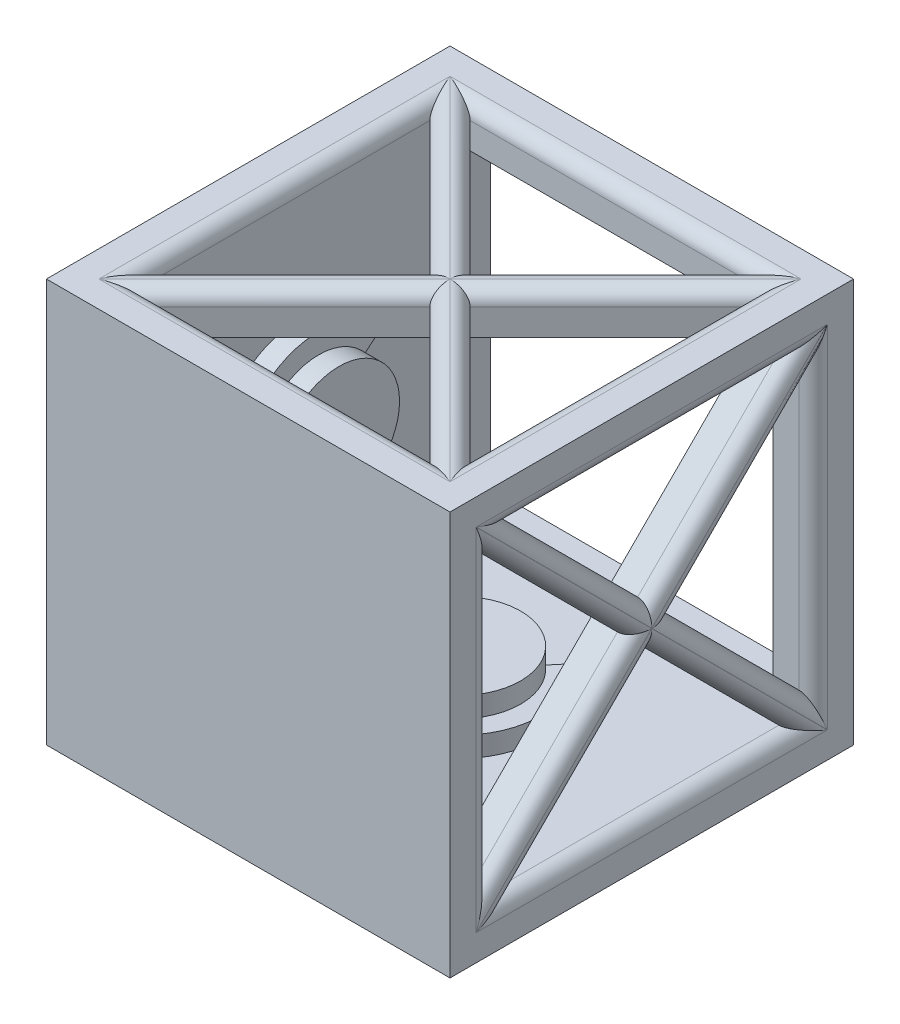
from build123d import *

# Parameters (mm, degrees)
SKETCH1_W            = 100
SKETCH1_H            = 100
BOSS_EXTRUDE1_DEPTH  = 100
SKETCH2_W            = 80
SKETCH2_H            = 80
CUT_EXTRUDE1_DEPTH   = 100
SKETCH3_W            = 80
SKETCH3_H            = 80
CUT_EXTRUDE2_DEPTH   = 100
CUT_EXTRUDE3_DEPTH   = 100
FILLET39_R           = 3.505
FILLET40_R           = 3.505
FILLET41_R           = 3.505
FILLET42_R           = 3.505
SKETCH5_W            = 80
SKETCH5_H            = 5
BOSS_EXTRUDE2_DEPTH  = 80
BOSS_EXTRUDE4_DEPTH  = 10
FILLET106_R          = 3.505
FILLET107_R          = 3.505
FILLET108_R          = 3.505
FILLET109_R          = 3.505
SKETCH10_W           = 100
SKETCH10_H           = 100
BOSS_EXTRUDE6_DEPTH  = 10
SKETCH11_W           = 100
SKETCH11_H           = 100
BOSS_EXTRUDE7_DEPTH  = 10
SKETCH12_R           = 15
BOSS_EXTRUDE8_DEPTH  = 10
BOSS_EXTRUDE9_DEPTH  = 5
SKETCH18_R           = 15
BOSS_EXTRUDE10_DEPTH = 10
BOSS_EXTRUDE11_DEPTH = 5
CUT_EXTRUDE4_DEPTH   = 10
SKETCH26_W           = 91.840928508
SKETCH26_H           = 89.348142656
BOSS_EXTRUDE12_DEPTH = 10
FILLET113_R          = 3.505
FILLET114_R          = 3.505
SKETCH28_R           = 15
BOSS_EXTRUDE13_DEPTH = 10
BOSS_EXTRUDE14_DEPTH = 5
FILLET115_R          = 3.505


# Some blends are built 0.0001 mm under size
with BuildPart() as part:
    # Sketch1 → Boss-Extrude1 (new body)
    with BuildSketch(Plane(origin=(0, 0, 0), x_dir=(1, 0, 0), z_dir=(0, 1, 0))):
        with Locations((-13.586701651, 24.731769861)):
            Rectangle(SKETCH1_W, SKETCH1_H)
    extrude(amount=BOSS_EXTRUDE1_DEPTH)

    # Sketch2 → Cut-Extrude1 (cut)
    with BuildSketch(Plane(origin=(0, 100, 0), x_dir=(1, 0, 0), z_dir=(0, 1, 0))):
        with Locations((-13.586701651, 24.731769861)):
            Rectangle(SKETCH2_W, SKETCH2_H)
    extrude(amount=-CUT_EXTRUDE1_DEPTH, mode=Mode.SUBTRACT)

    # Sketch3 → Cut-Extrude2 (cut)
    with BuildSketch(Plane.XY.offset(25.268230139)):
        with Locations((-13.586701651, 50)):
            Rectangle(SKETCH3_W, SKETCH3_H)
    extrude(amount=-CUT_EXTRUDE2_DEPTH, mode=Mode.SUBTRACT)

    # Sketch4 → Cut-Extrude3 (cut)
    with BuildSketch(Plane.ZY.offset(63.586701651)):
        Polygon((-59.731769861, 10), (10.268230139, 10), (-24.731769861, 45), align=None)
        Polygon((-64.731769861, 15), (-29.731769861, 50), (-64.731769861, 85), align=None)
        Polygon((-59.731769861, 90), (-24.731769861, 55), (10.268230139, 90), align=None)
        Polygon((-19.731769861, 50), (15.268230139, 15), (15.268230139, 85), align=None)
    extrude(amount=-CUT_EXTRUDE3_DEPTH, mode=Mode.SUBTRACT)

    # Fillet39
    # the kernel refuses this fillet: 3.505 mm, written as the material it adds along each edge
    with BuildSketch(Plane(origin=(-63.586701651, 45, -24.731769861), x_dir=(0, -0.7071067811865476, -0.7071067811865476), z_dir=(1, 0, 0))) as fillet39_piece_1:
        with BuildLine():
            CenterArc((FILLET39_R, -FILLET39_R), FILLET39_R, 90, 90)
            Line((0, -FILLET39_R), (0, 0))
            Line((0, 0), (FILLET39_R, 0))
        make_face()
    extrude(amount=10)
    with BuildSketch(Plane(origin=(-63.586701651, 10, 10.268230139), x_dir=(0, 0, -1), z_dir=(1, 0, 0))) as fillet39_piece_2:
        with BuildLine():
            CenterArc((FILLET39_R * 2.41421356237, FILLET39_R), FILLET39_R, 135, 135)
            Line((FILLET39_R * 1.70710678119, FILLET39_R * 1.70710678119), (0, 0))
            Line((0, 0), (FILLET39_R * 2.41421356237, 0))
        make_face()
    extrude(amount=10)
    # the kernel refuses this fillet: 3.505 mm, written as the material it takes off along each edge
    with BuildSketch(Plane(origin=(-63.586701651, 15.983409268, 4.284820871), x_dir=(0, 0.7071067811865476, 0.7071067811865476), z_dir=(0, 0.7071067811865475, -0.7071067811865476)), Plane(origin=(-53.586701651, 42.521590732, -22.253360593), x_dir=(0, 0.7071067811865476, 0.7071067811865476), z_dir=(0, -0.7071067811865475, 0.7071067811865476))) as fillet39_2_piece_1:
        with BuildLine():
            CenterArc((FILLET39_R, FILLET39_R), FILLET39_R, 180, 90)
            Line((0, FILLET39_R), (0, 0))
            Line((0, 0), (FILLET39_R, 0))
        make_face()
    extrude(amount=37.530656147, mode=Mode.SUBTRACT)
    with BuildSketch(Plane(origin=(-63.586701651, 10, -68.494269861), x_dir=(0, -1, 0), z_dir=(0, 0, 1))) as fillet39_2_piece_2_section:
        with BuildLine():
            CenterArc((FILLET39_R, FILLET39_R), FILLET39_R, 180, 90)
            Line((0, FILLET39_R), (0, 0))
            Line((0, 0), (FILLET39_R, 0))
        make_face()
    fillet39_2_piece_2 = extrude(amount=70.300681464, mode=Mode.PRIVATE)
    fillet39_2_piece_2 = split(fillet39_2_piece_2, bisect_by=Plane(origin=(-62.798598249, 24.782539109, -44.949230752), z_dir=(0, -0.7071067811865476, 0.7071067811865476)), keep=Keep.TOP, mode=Mode.PRIVATE)
    add(fillet39_2_piece_2, mode=Mode.SUBTRACT)
    with BuildSketch(Plane(origin=(-53.586701651, 3.80397683, -65.927793031), x_dir=(0, 0.7071067811865475, -0.7071067811865475), z_dir=(0, 0.7071067811865476, 0.7071067811865476))) as fillet39_2_piece_3_section:
        with BuildLine():
            CenterArc((FILLET39_R, FILLET39_R), FILLET39_R, 180, 90)
            Line((0, FILLET39_R), (0, 0))
            Line((0, 0), (FILLET39_R, 0))
        make_face()
    fillet39_2_piece_3 = extrude(amount=54.754974683, mode=Mode.PRIVATE)
    fillet39_2_piece_3 = split(fillet39_2_piece_3, bisect_by=Plane(origin=(-54.373006967, 10, -44.325568199), z_dir=(0, 1, 0)), keep=Keep.TOP, mode=Mode.PRIVATE)
    add(fillet39_2_piece_3, mode=Mode.SUBTRACT)
    with BuildSketch(Plane(origin=(-53.586701651, 10, 1.806411603), x_dir=(0, -1, 0), z_dir=(0, 0, -1))) as fillet39_2_piece_4_section:
        with BuildLine():
            CenterArc((FILLET39_R, FILLET39_R), FILLET39_R, 180, 90)
            Line((0, FILLET39_R), (0, 0))
            Line((0, 0), (FILLET39_R, 0))
        make_face()
    fillet39_2_piece_4 = extrude(amount=70.300681464, mode=Mode.PRIVATE)
    fillet39_2_piece_4 = split(fillet39_2_piece_4, bisect_by=Plane(origin=(-54.374805052, 24.782539109, -44.949230752), z_dir=(0, -0.7071067811865476, 0.7071067811865476)), keep=Keep.TOP, mode=Mode.PRIVATE)
    add(fillet39_2_piece_4, mode=Mode.SUBTRACT)
    with BuildSketch(Plane(origin=(-63.586701651, 42.521590732, -27.210179129), x_dir=(0, 0.7071067811865476, -0.7071067811865476), z_dir=(0, -0.7071067811865476, -0.7071067811865476))) as fillet39_2_piece_5_section:
        with BuildLine():
            CenterArc((FILLET39_R, FILLET39_R), FILLET39_R, 180, 90)
            Line((0, FILLET39_R), (0, 0))
            Line((0, 0), (FILLET39_R, 0))
        make_face()
    fillet39_2_piece_5 = extrude(amount=54.754974683, mode=Mode.PRIVATE)
    fillet39_2_piece_5 = split(fillet39_2_piece_5, bisect_by=Plane(origin=(-62.800396334, 10, -44.325568199), z_dir=(0, 1, 0)), keep=Keep.TOP, mode=Mode.PRIVATE)
    add(fillet39_2_piece_5, mode=Mode.SUBTRACT)
    with BuildSketch(Plane(origin=(-63.586701651, 40.043181464, -24.731769861), x_dir=(0, 0.7071067811865476, -0.7071067811865476), z_dir=(0, -0.7071067811865476, -0.7071067811865476))) as fillet39_2_piece_6:
        with BuildLine():
            CenterArc((3.505 + FILLET39_R, FILLET39_R), FILLET39_R, 180, 90)
            Line((3.505, FILLET39_R), (3.505, 0))
            Line((3.505, 0), (3.505 + FILLET39_R, 0))
        make_face()
    revolve(axis=Axis((-63.586701651, 40.043181464, -24.731769861), (1, 0, 0)), revolution_arc=90, mode=Mode.SUBTRACT)
    with BuildSketch(Plane(origin=(-53.586701651, 13.505, 1.806411603), x_dir=(0, -1, 0), z_dir=(0, 0, -1))) as fillet39_2_piece_7:
        with BuildLine():
            CenterArc((3.505 + FILLET39_R, FILLET39_R), FILLET39_R, 180, 90)
            Line((3.505, FILLET39_R), (3.505, 0))
            Line((3.505, 0), (3.505 + FILLET39_R, 0))
        make_face()
    revolve(axis=Axis((-53.586701651, 13.505, 1.806411603), (-1, 0, 0)), revolution_arc=135, mode=Mode.SUBTRACT)
    with BuildSketch(Plane(origin=(-53.586701651, 40.043181464, -24.731769861), x_dir=(0, 0.7071067811865476, -0.7071067811865476), z_dir=(0, -0.7071067811865476, -0.7071067811865476))) as fillet39_2_piece_8:
        with BuildLine():
            CenterArc((3.505 + FILLET39_R, -FILLET39_R), FILLET39_R, 90, 90)
            Line((3.505, -FILLET39_R), (3.505, 0))
            Line((3.505, 0), (3.505 + FILLET39_R, 0))
        make_face()
    revolve(axis=Axis((-53.586701651, 40.043181464, -24.731769861), (1, 0, 0)), revolution_arc=90, mode=Mode.SUBTRACT)
    with BuildSketch(Plane(origin=(-63.586701651, 13.505, 1.806411603), x_dir=(0, -1, 0), z_dir=(0, 0, -1))) as fillet39_2_piece_9:
        with BuildLine():
            CenterArc((3.505 + FILLET39_R, -FILLET39_R), FILLET39_R, 90, 90)
            Line((3.505, -FILLET39_R), (3.505, 0))
            Line((3.505, 0), (3.505 + FILLET39_R, 0))
        make_face()
    revolve(axis=Axis((-63.586701651, 13.505, 1.806411603), (-1, 0, 0)), revolution_arc=135, mode=Mode.SUBTRACT)
    with BuildSketch(Plane(origin=(-63.586701651, 42.521590732, -27.210179129), x_dir=(0, 0.7071067811865476, -0.7071067811865476), z_dir=(0, -0.7071067811865476, -0.7071067811865476))) as fillet39_2_piece_10a_section:
        with BuildLine():
            CenterArc((FILLET39_R, FILLET39_R), FILLET39_R, 180, 90)
            Line((0, FILLET39_R), (0, 0))
            Line((0, 0), (FILLET39_R, 0))
        make_face()
    fillet39_2_piece_10a = extrude(amount=54.754974683, mode=Mode.PRIVATE)
    fillet39_2_piece_10a = split(fillet39_2_piece_10a, bisect_by=Plane(origin=(-62.750859381, 10, -63.595436252), z_dir=(0, -1, 0)), keep=Keep.TOP, mode=Mode.PRIVATE)
    with BuildSketch(Plane(origin=(-63.586701651, 10, -68.494269861), x_dir=(0, -1, 0), z_dir=(0, 0, 1))) as fillet39_2_piece_10b_section:
        with BuildLine():
            CenterArc((FILLET39_R, FILLET39_R), FILLET39_R, 180, 90)
            Line((0, FILLET39_R), (0, 0))
            Line((0, 0), (FILLET39_R, 0))
        make_face()
    fillet39_2_piece_10b = extrude(amount=70.300681464, mode=Mode.PRIVATE)
    fillet39_2_piece_10b = split(fillet39_2_piece_10b, bisect_by=Plane(origin=(-62.750859381, 7.267975294, -62.463794567), z_dir=(0, 0.7071067811865476, -0.7071067811865476)), keep=Keep.TOP, mode=Mode.PRIVATE)
    fillet39_2_piece_10 = fillet39_2_piece_10a & fillet39_2_piece_10b
    add(fillet39_2_piece_10, mode=Mode.SUBTRACT)
    with BuildSketch(Plane(origin=(-53.586701651, 3.80397683, -65.927793031), x_dir=(0, 0.7071067811865475, -0.7071067811865475), z_dir=(0, 0.7071067811865476, 0.7071067811865476))) as fillet39_2_piece_11a_section:
        with BuildLine():
            CenterArc((FILLET39_R, FILLET39_R), FILLET39_R, 180, 90)
            Line((0, FILLET39_R), (0, 0))
            Line((0, 0), (FILLET39_R, 0))
        make_face()
    fillet39_2_piece_11a = extrude(amount=54.754974683, mode=Mode.PRIVATE)
    fillet39_2_piece_11a = split(fillet39_2_piece_11a, bisect_by=Plane(origin=(-54.503230396, 7.913859932, -64.731769861), z_dir=(0, 0, 1)), keep=Keep.TOP, mode=Mode.PRIVATE)
    fillet39_2_piece_11a = split(fillet39_2_piece_11a, bisect_by=Plane(origin=(-54.503230396, 10, -62.645629793), z_dir=(0, -1, 0)), keep=Keep.TOP, mode=Mode.PRIVATE)
    with BuildSketch(Plane(origin=(-53.586701651, 10, 1.806411603), x_dir=(0, -1, 0), z_dir=(0, 0, -1))) as fillet39_2_piece_11b_section:
        with BuildLine():
            CenterArc((FILLET39_R, FILLET39_R), FILLET39_R, 180, 90)
            Line((0, FILLET39_R), (0, 0))
            Line((0, 0), (FILLET39_R, 0))
        make_face()
    fillet39_2_piece_11b = extrude(amount=70.300681464, mode=Mode.PRIVATE)
    fillet39_2_piece_11b = split(fillet39_2_piece_11b, bisect_by=Plane(origin=(-54.460403752, 9.342219977, -64.731769861), z_dir=(0, 0, 1)), keep=Keep.TOP, mode=Mode.PRIVATE)
    fillet39_2_piece_11b = split(fillet39_2_piece_11b, bisect_by=Plane(origin=(-54.460403752, 8.256664983, -61.475104878), z_dir=(0, 0.7071067811865476, -0.7071067811865476)), keep=Keep.TOP, mode=Mode.PRIVATE)
    fillet39_2_piece_11 = fillet39_2_piece_11a & fillet39_2_piece_11b
    add(fillet39_2_piece_11, mode=Mode.SUBTRACT)

    # Fillet40
    fillet40_edges = [part.edges().sort_by_distance(p)[0] for p in [
        (-63.586701651, 72.5, -42.231769861),
        (-58.586701651, 90, -59.731769861),
        (-63.586701651, 90, -24.731769861),
        (-53.586701651, 72.5, -7.231769861),
        (-58.586701651, 90, 10.268230139),
        (-53.586701651, 72.5, -42.231769861),
        (-53.586701651, 90, -24.731769861),
        (-63.586701651, 72.5, -7.231769861),
    ]]
    fillet(fillet40_edges, radius=FILLET40_R)

    # Fillet41
    fillet41_edges = [part.edges().sort_by_distance(p)[0] for p in [
        (-58.586701651, 85, 15.268230139),
        (-63.586701651, 50, 15.268230139),
        (-58.586701651, 15, 15.268230139),
        (-63.586701651, 32.5, -2.231769861),
        (-53.586701651, 67.5, -2.231769861),
        (-53.586701651, 50, 15.268230139),
        (-53.586701651, 32.5, -2.231769861),
        (-63.586701651, 67.5, -2.231769861),
    ]]
    fillet(fillet41_edges, radius=FILLET41_R - 0.0001)  # a hair under: the kernel refuses the full size

    # Fillet42
    # the kernel refuses this fillet: 3.505 mm, written as the material it adds along each edge
    with BuildSketch(Plane(origin=(-63.586701651, 85, -64.731769861), x_dir=(0, -1, 0), z_dir=(1, 0, 0))) as fillet42_piece_1:
        with BuildLine():
            CenterArc((FILLET42_R * 2.41421356237, -FILLET42_R), FILLET42_R, 90, 135)
            Line((FILLET42_R * 1.70710678119, -FILLET42_R * 1.70710678119), (0, 0))
            Line((0, 0), (FILLET42_R * 2.41421356237, 0))
        make_face()
    extrude(amount=10)
    with BuildSketch(Plane(origin=(-63.586701651, 50, -29.731769861), x_dir=(0, 0.7071067811865465, -0.7071067811865486), z_dir=(1, 0, 0))) as fillet42_piece_2:
        with BuildLine():
            CenterArc((FILLET42_R, -FILLET42_R), FILLET42_R, 90, 90)
            Line((0, -FILLET42_R), (0, 0))
            Line((0, 0), (FILLET42_R, 0))
        make_face()
    extrude(amount=10)
    # the kernel refuses this fillet: 3.505 mm, written as the material it takes off along each edge
    with BuildSketch(Plane(origin=(-63.586701651, 76.538181464, -64.731769861), x_dir=(0, 0, -1), z_dir=(0, -1, 0))) as fillet42_2_piece_1_section:
        with BuildLine():
            CenterArc((FILLET42_R, FILLET42_R), FILLET42_R, 180, 90)
            Line((0, FILLET42_R), (0, 0))
            Line((0, 0), (FILLET42_R, 0))
        make_face()
    fillet42_2_piece_1 = extrude(amount=70.300681464, mode=Mode.PRIVATE)
    fillet42_2_piece_1 = split(fillet42_2_piece_1, bisect_by=Plane(origin=(-62.798598249, 29.782539109, -49.949230752), z_dir=(0, 0.7071067811865477, -0.7071067811865475)), keep=Keep.TOP, mode=Mode.PRIVATE)
    add(fillet42_2_piece_1, mode=Mode.SUBTRACT)
    with BuildSketch(Plane(origin=(-63.586701651, 52.478409268, -32.210179129), x_dir=(-5.270787768833835e-14, 0.7071067811865476, 0.7071067811865474), z_dir=(0, 0.7071067811865475, -0.7071067811865476)), Plane(origin=(-53.586701651, 79.016590732, -58.748360593), x_dir=(-5.473510375327444e-14, 0.7071067811865476, 0.7071067811865474), z_dir=(0, -0.7071067811865475, 0.7071067811865476))) as fillet42_2_piece_2:
        with BuildLine():
            CenterArc((FILLET42_R, FILLET42_R), FILLET42_R, 180, 90)
            Line((0, FILLET42_R), (0, 0))
            Line((0, 0), (FILLET42_R, 0))
        make_face()
    extrude(amount=37.530656147, mode=Mode.SUBTRACT)
    with BuildSketch(Plane(origin=(-53.586701651, 47.521590732, -32.210179129), x_dir=(-1, 0, 0), z_dir=(0, -0.7071067811865475, -0.7071067811865477))) as fillet42_2_piece_3_section:
        with BuildLine():
            CenterArc((FILLET42_R, -FILLET42_R), FILLET42_R, 90, 90)
            Line((0, -FILLET42_R), (0, 0))
            Line((0, 0), (FILLET42_R, 0))
        make_face()
    fillet42_2_piece_3 = extrude(amount=54.754974683, mode=Mode.PRIVATE)
    fillet42_2_piece_3 = split(fillet42_2_piece_3, bisect_by=Plane(origin=(-54.373006967, 30.406201662, -64.731769861), z_dir=(0, 0, 1)), keep=Keep.TOP, mode=Mode.PRIVATE)
    add(fillet42_2_piece_3, mode=Mode.SUBTRACT)
    with BuildSketch(Plane(origin=(-53.586701651, 6.2375, -64.731769861), x_dir=(0, 0, -1), z_dir=(0, 1, 0))) as fillet42_2_piece_4_section:
        with BuildLine():
            CenterArc((FILLET42_R, FILLET42_R), FILLET42_R, 180, 90)
            Line((0, FILLET42_R), (0, 0))
            Line((0, 0), (FILLET42_R, 0))
        make_face()
    fillet42_2_piece_4 = extrude(amount=70.300681464, mode=Mode.PRIVATE)
    fillet42_2_piece_4 = split(fillet42_2_piece_4, bisect_by=Plane(origin=(-54.374805052, 29.782539109, -49.949230752), z_dir=(0, 0.7071067811865477, -0.7071067811865475)), keep=Keep.TOP, mode=Mode.PRIVATE)
    add(fillet42_2_piece_4, mode=Mode.SUBTRACT)
    with BuildSketch(Plane(origin=(-63.586701651, 8.80397683, -70.927793031), x_dir=(0, -0.7071067811865476, 0.7071067811865474), z_dir=(0, 0.7071067811865475, 0.7071067811865477))) as fillet42_2_piece_5_section:
        with BuildLine():
            CenterArc((FILLET42_R, FILLET42_R), FILLET42_R, 180, 90)
            Line((0, FILLET42_R), (0, 0))
            Line((0, 0), (FILLET42_R, 0))
        make_face()
    fillet42_2_piece_5 = extrude(amount=54.754974683, mode=Mode.PRIVATE)
    fillet42_2_piece_5 = split(fillet42_2_piece_5, bisect_by=Plane(origin=(-62.800396334, 30.406201662, -64.731769861), z_dir=(0, 0, 1)), keep=Keep.TOP, mode=Mode.PRIVATE)
    add(fillet42_2_piece_5, mode=Mode.SUBTRACT)
    with BuildSketch(Plane(origin=(-63.586701651, 50, -34.688588397), x_dir=(0, 0.7071067811865476, 0.7071067811865476), z_dir=(0, 0.7071067811865476, -0.7071067811865476))) as fillet42_2_piece_6:
        with BuildLine():
            CenterArc((3.505 + FILLET42_R, FILLET42_R), FILLET42_R, 180, 90)
            Line((3.505, FILLET42_R), (3.505, 0))
            Line((3.505, 0), (3.505 + FILLET42_R, 0))
        make_face()
    revolve(axis=Axis((-63.586701651, 50, -34.688588397), (1, 0, 0)), revolution_arc=90, mode=Mode.SUBTRACT)
    with BuildSketch(Plane(origin=(-53.586701651, 76.538181464, -61.226769861), x_dir=(0, 0, -1), z_dir=(0, -1, 0))) as fillet42_2_piece_7:
        with BuildLine():
            CenterArc((3.505 + FILLET42_R, -FILLET42_R), FILLET42_R, 90, 90)
            Line((3.505, -FILLET42_R), (3.505, 0))
            Line((3.505, 0), (3.505 + FILLET42_R, 0))
        make_face()
    revolve(axis=Axis((-53.586701651, 76.538181464, -61.226769861), (1, 0, 0)), revolution_arc=135, mode=Mode.SUBTRACT)
    with BuildSketch(Plane(origin=(-53.586701651, 50, -34.688588397), x_dir=(0, 0.7071067811865476, 0.7071067811865476), z_dir=(0, 0.7071067811865476, -0.7071067811865476))) as fillet42_2_piece_8:
        with BuildLine():
            CenterArc((3.505 + FILLET42_R, -FILLET42_R), FILLET42_R, 90, 90)
            Line((3.505, -FILLET42_R), (3.505, 0))
            Line((3.505, 0), (3.505 + FILLET42_R, 0))
        make_face()
    revolve(axis=Axis((-53.586701651, 50, -34.688588397), (1, 0, 0)), revolution_arc=90, mode=Mode.SUBTRACT)
    with BuildSketch(Plane(origin=(-63.586701651, 76.538181464, -61.226769861), x_dir=(0, 0, -1), z_dir=(0, -1, 0))) as fillet42_2_piece_9:
        with BuildLine():
            CenterArc((3.505 + FILLET42_R, FILLET42_R), FILLET42_R, 180, 90)
            Line((3.505, FILLET42_R), (3.505, 0))
            Line((3.505, 0), (3.505 + FILLET42_R, 0))
        make_face()
    revolve(axis=Axis((-63.586701651, 76.538181464, -61.226769861), (1, 0, 0)), revolution_arc=135, mode=Mode.SUBTRACT)
    with BuildSketch(Plane(origin=(-63.586701651, 76.538181464, -64.731769861), x_dir=(0, 0, -1), z_dir=(0, -1, 0))) as fillet42_2_piece_10a_section:
        with BuildLine():
            CenterArc((FILLET42_R, FILLET42_R), FILLET42_R, 180, 90)
            Line((0, FILLET42_R), (0, 0))
            Line((0, 0), (FILLET42_R, 0))
        make_face()
    fillet42_2_piece_10a = extrude(amount=70.300681464, mode=Mode.PRIVATE)
    fillet42_2_piece_10a = split(fillet42_2_piece_10a, bisect_by=Plane(origin=(-62.750859381, 12.267975294, -67.463794567), z_dir=(0, -0.7071067811865477, 0.7071067811865475)), keep=Keep.TOP, mode=Mode.PRIVATE)
    with BuildSketch(Plane(origin=(-63.586701651, 8.80397683, -70.927793031), x_dir=(0, -0.7071067811865476, 0.7071067811865474), z_dir=(0, 0.7071067811865475, 0.7071067811865477))) as fillet42_2_piece_10b_section:
        with BuildLine():
            CenterArc((FILLET42_R, FILLET42_R), FILLET42_R, 180, 90)
            Line((0, FILLET42_R), (0, 0))
            Line((0, 0), (FILLET42_R, 0))
        make_face()
    fillet42_2_piece_10b = extrude(amount=54.754974683, mode=Mode.PRIVATE)
    fillet42_2_piece_10b = split(fillet42_2_piece_10b, bisect_by=Plane(origin=(-62.750859381, 11.136333609, -64.731769861), z_dir=(0, 0, -1)), keep=Keep.TOP, mode=Mode.PRIVATE)
    fillet42_2_piece_10 = fillet42_2_piece_10a & fillet42_2_piece_10b
    add(fillet42_2_piece_10, mode=Mode.SUBTRACT)
    with BuildSketch(Plane(origin=(-53.586701651, 47.521590732, -32.210179129), x_dir=(-1, 0, 0), z_dir=(0, -0.7071067811865475, -0.7071067811865477))) as fillet42_2_piece_11a_section:
        with BuildLine():
            CenterArc((FILLET42_R, -FILLET42_R), FILLET42_R, 90, 90)
            Line((0, -FILLET42_R), (0, 0))
            Line((0, 0), (FILLET42_R, 0))
        make_face()
    fillet42_2_piece_11a = extrude(amount=54.754974683, mode=Mode.PRIVATE)
    fillet42_2_piece_11a = split(fillet42_2_piece_11a, bisect_by=Plane(origin=(-54.503230396, 12.086140068, -64.731769861), z_dir=(0, 0, -1)), keep=Keep.TOP, mode=Mode.PRIVATE)
    fillet42_2_piece_11a = split(fillet42_2_piece_11a, bisect_by=Plane(origin=(-54.503230396, 10, -66.817909929), z_dir=(0, 1, 0)), keep=Keep.TOP, mode=Mode.PRIVATE)
    with BuildSketch(Plane(origin=(-53.586701651, 6.2375, -64.731769861), x_dir=(0, 0, -1), z_dir=(0, 1, 0))) as fillet42_2_piece_11b_section:
        with BuildLine():
            CenterArc((FILLET42_R, FILLET42_R), FILLET42_R, 180, 90)
            Line((0, FILLET42_R), (0, 0))
            Line((0, 0), (FILLET42_R, 0))
        make_face()
    fillet42_2_piece_11b = extrude(amount=70.300681464, mode=Mode.PRIVATE)
    fillet42_2_piece_11b = split(fillet42_2_piece_11b, bisect_by=Plane(origin=(-54.031936123, 13.371370658, -66.360399203), z_dir=(0, -0.7071067811865477, 0.7071067811865475)), keep=Keep.TOP, mode=Mode.PRIVATE)
    fillet42_2_piece_11b = split(fillet42_2_piece_11b, bisect_by=Plane(origin=(-54.031936123, 10, -65.671792575), z_dir=(0, 1, 0)), keep=Keep.TOP, mode=Mode.PRIVATE)
    fillet42_2_piece_11b = fillet42_2_piece_11b - Plane(origin=(-57.091701651, 10.849779926, -63.838808471), x_dir=(0, 0.7071067811865476, -0.7071067811865476), z_dir=(0, -0.7071067811865476, -0.7071067811865476)) * Cylinder(3.505, 155, mode=Mode.PRIVATE)
    fillet42_2_piece_11 = fillet42_2_piece_11a & fillet42_2_piece_11b
    add(fillet42_2_piece_11, mode=Mode.SUBTRACT)

    # Sketch5 → Boss-Extrude2 (add)
    with BuildSketch(Plane(origin=(0, 10, 0), x_dir=(1, 0, 0), z_dir=(0, 1, 0))):
        with Locations((-13.586701651, -22.768230139)):
            Rectangle(SKETCH5_W, SKETCH5_H)
    extrude(amount=BOSS_EXTRUDE2_DEPTH)

    # Sketch9 → Boss-Extrude4 (add)
    with BuildSketch(Plane(origin=(0, 100, 0), x_dir=(1, 0, 0), z_dir=(0, 1, 0))):
        Polygon((-13.529146595, 19.789324917), (-8.529146595, 24.789324917), (-13.536340977, 29.782130535), (-18.536340977, 24.782130535), align=None)
        Polygon((-18.536340977, 24.782130535), (-13.536340977, 29.782130535), (-48.586701651, 64.731769861), (-53.586701651, 64.731769861), (-53.586701651, 59.731769861), align=None)
        Polygon((-48.586701651, -15.268230139), (-13.529146595, 19.789324917), (-18.536340977, 24.782130535), (-53.586701651, -10.268230139), (-53.586701651, -15.268230139), align=None)
        Polygon((21.413298349, -15.052708789), (26.413298349, -15.052708789), (26.413298349, -10.052708789), (-8.529146595, 24.789324917), (-13.529146595, 19.789324917), align=None)
        Polygon((-13.536340977, 29.782130535), (-8.529146595, 24.789324917), (26.413298349, 59.731769861), (26.413298349, 64.731769861), (21.413298349, 64.731769861), align=None)
    boss_extrude4 = extrude(amount=-BOSS_EXTRUDE4_DEPTH)

    # Fillet106
    fillet106_edges = [part.edges().sort_by_distance(p)[0] for p in [
        (-13.586701651, 100, -64.731769861),
    ]]
    fillet(fillet106_edges, radius=FILLET106_R)

    # Fillet107
    fillet107_edges = [part.edges().sort_by_distance(p)[0] for p in [
        (26.413298349, 100, -24.839530536),
        (5.690978686, 100, -49.009450198),
        (-32.819071843, 100, -49.009450198),
        (-53.586701651, 100, -24.731769861),
        (-36.061521314, 100, -42.256950198),
        (-36.061521314, 100, -7.256950198),
        (-31.057924123, 100, -2.260547389),
        (3.942075877, 100, -2.368308064),
        (8.942075877, 100, -42.260547389),
        (8.942075877, 100, -7.368308064),
    ]]
    fillet(fillet107_edges, radius=FILLET107_R)

    # Fillet108
    fillet108_edges = [part.edges().sort_by_distance(p)[0] for p in [
        (-13.565110919, 100, 15.268230139),
    ]]
    fillet(fillet108_edges, radius=FILLET108_R)

    # Mirror3: Boss-Extrude4 across plane
    add(boss_extrude4.mirror(Plane.ZX.offset(50)))

    # Fillet109
    fillet109_edges = [part.edges().sort_by_distance(p)[0] for p in [
        (-11.086701651, 0, 15.268230139),
        (-13.586701651, 0, -64.731769861),
        (-53.586701651, 0, -24.731769861),
        (26.413298349, 0, -24.839530536),
        (8.942075877, 0, -42.260547389),
        (-36.061521314, 0, -42.256950198),
        (-31.057924123, 0, -2.260547389),
        (3.942075877, 0, -2.368308064),
        (8.942075877, 0, -7.368308064),
        (-36.061521314, 0, -7.256950198),
        (-31.061521314, 0, -47.256950198),
        (3.938478686, 0, -47.256950198),
    ]]
    fillet(fillet109_edges, radius=FILLET109_R)

    # Sketch10 → Boss-Extrude6 (add)
    with BuildSketch(Plane(origin=(0, 0, 0), x_dir=(-1, 0, 0), z_dir=(0, -1, 0))):
        with Locations((13.586701651, 24.731769861)):
            Rectangle(SKETCH10_W, SKETCH10_H)
    extrude(amount=-BOSS_EXTRUDE6_DEPTH)

    # Sketch11 → Boss-Extrude7 (add)
    with BuildSketch(Plane(origin=(0, 100, 0), x_dir=(1, 0, 0), z_dir=(0, 1, 0))):
        with Locations((-13.586701651, 24.731769861)):
            Rectangle(SKETCH11_W, SKETCH11_H)
    extrude(amount=-BOSS_EXTRUDE7_DEPTH)

    # Sketch12 → Boss-Extrude8 (add)
    with BuildSketch(Plane(origin=(0, 0, 20.268230139), x_dir=(-1, 0, 0), z_dir=(0, 0, -1))):
        with Locations(Location((13.586701651, 50, 0), (0, 0, 180))):
            Circle(SKETCH12_R)
    extrude(amount=BOSS_EXTRUDE8_DEPTH)

    # Sketch13 → Boss-Extrude9 (add)
    with BuildSketch(Plane(origin=(0, 0, 20.268230139), x_dir=(-1, 0, 0), z_dir=(0, 0, -1))):
        with BuildLine():
            Line((-0.555433973, 64.142135624), (2.980099933, 60.606601718))
            ThreePointArc((2.980099933, 60.606601718), (-1.413298349, 50), (2.980099933, 39.393398282))
            Line((2.980099933, 39.393398282), (-0.555433973, 35.857864376))
            ThreePointArc((-0.555433973, 35.857864376), (-6.413298349, 50), (-0.555433973, 64.142135624))
        make_face()
        with BuildLine():
            Line((27.728837274, 64.142135624), (24.193303368, 60.606601718))
            ThreePointArc((24.193303368, 60.606601718), (28.586701651, 50), (24.193303368, 39.393398282))
            Line((24.193303368, 39.393398282), (27.728837274, 35.857864376))
            ThreePointArc((27.728837274, 35.857864376), (33.586701651, 50), (27.728837274, 64.142135624))
        make_face()
    extrude(amount=BOSS_EXTRUDE9_DEPTH)

    # Sketch18 → Boss-Extrude10 (add)
    with BuildSketch(Plane(origin=(0, 10, 0), x_dir=(1, 0, 0), z_dir=(0, 1, 0))):
        with Locations(Location((-13.586701651, 27.231769861, 0), (0, 0, 90))):
            Circle(SKETCH18_R)
    extrude(amount=BOSS_EXTRUDE10_DEPTH)

    # Sketch19 → Boss-Extrude11 (add)
    with BuildSketch(Plane(origin=(0, 10, 0), x_dir=(1, 0, 0), z_dir=(0, 1, 0))):
        with BuildLine():
            Line((-26.469416566, 42.529993823), (-23.248737837, 38.705437833))
            ThreePointArc((-23.248737837, 38.705437833), (-28.586701651, 27.231769861), (-23.248737837, 15.758101889))
            Line((-23.248737837, 15.758101889), (-26.469416566, 11.933545899))
            ThreePointArc((-26.469416566, 11.933545899), (-33.586701651, 27.231769861), (-26.469416566, 42.529993823))
        make_face()
        with BuildLine():
            Line((-3.924665464, 15.758101889), (-0.703986735, 11.933545899))
            ThreePointArc((-0.703986735, 11.933545899), (6.413298349, 27.231769861), (-0.703986735, 42.529993823))
            Line((-0.703986735, 42.529993823), (-3.924665464, 38.705437833))
            ThreePointArc((-3.924665464, 38.705437833), (1.413298349, 27.231769861), (-3.924665464, 15.758101889))
        make_face()
    extrude(amount=BOSS_EXTRUDE11_DEPTH)

    # Sketch25 → Cut-Extrude4 (cut)
    with BuildSketch(Plane(origin=(0, 100, 0), x_dir=(1, 0, 0), z_dir=(0, 1, 0))):
        Polygon((26.413298349, 59.731769861), (-8.586701651, 24.731769861), (26.413298349, -10.268230139), align=None)
        Polygon((21.413298349, -15.268230139), (-13.586701651, 19.731769861), (-48.586701651, -15.268230139), align=None)
        Polygon((-18.586701651, 24.731769861), (-53.586701651, 59.731769861), (-53.586701651, -10.268230139), align=None)
        Polygon((21.413298349, 64.731769861), (-48.586701651, 64.731769861), (-13.586701651, 29.731769861), align=None)
    extrude(amount=-CUT_EXTRUDE4_DEPTH, mode=Mode.SUBTRACT)

    # Sketch26 → Boss-Extrude12 (add)
    with BuildSketch(Plane.ZY.offset(63.586701651)):
        with Locations((-24.385211709, 50.758041136)):
            Rectangle(SKETCH26_W, SKETCH26_H)
    extrude(amount=-BOSS_EXTRUDE12_DEPTH)

    # Fillet113
    fillet113_edges = [part.edges().sort_by_distance(p)[0] for p in [
        (26.413298349, 100, -24.731769861),
    ]]
    fillet(fillet113_edges, radius=FILLET113_R)

    # Fillet114
    fillet114_edges = [part.edges().sort_by_distance(p)[0] for p in [
        (36.413298349, 72.5, -7.231769861),
        (36.413298349, 72.5, -42.231769861),
        (36.413298349, 90, -24.731769861),
        (36.413298349, 67.5, -2.231769861),
        (36.413298349, 50, 15.268230139),
        (36.413298349, 32.5, -2.231769861),
        (36.413298349, 27.5, -42.231769861),
        (36.413298349, 27.5, -7.231769861),
        (36.413298349, 10, -24.731769861),
        (36.413298349, 32.5, -47.231769861),
        (36.413298349, 50, -64.731769861),
        (36.413298349, 67.5, -47.231769861),
    ]]
    fillet(fillet114_edges, radius=FILLET114_R)

    # Sketch28 → Boss-Extrude13 (add)
    with BuildSketch(Plane(origin=(-53.586701651, 0, 0), x_dir=(0, 0, -1), z_dir=(1, 0, 0))):
        with Locations(Location((27.231769861, 50, 0), (0, 0, 180))):
            Circle(SKETCH28_R)
    extrude(amount=BOSS_EXTRUDE13_DEPTH)

    # Sketch29 → Boss-Extrude14 (add)
    with BuildSketch(Plane(origin=(-53.586701651, 0, 0), x_dir=(0, 0, -1), z_dir=(1, 0, 0))):
        with BuildLine():
            Line((38.705437833, 59.662036187), (42.529993823, 62.882714916))
            ThreePointArc((42.529993823, 62.882714916), (27.231769861, 70), (11.933545899, 62.882714916))
            Line((11.933545899, 62.882714916), (15.758101889, 59.662036187))
            ThreePointArc((15.758101889, 59.662036187), (27.231769861, 65), (38.705437833, 59.662036187))
        make_face()
        with BuildLine():
            Line((38.705437833, 40.337963813), (42.529993823, 37.117285084))
            ThreePointArc((42.529993823, 37.117285084), (27.231769861, 30), (11.933545899, 37.117285084))
            Line((11.933545899, 37.117285084), (15.758101889, 40.337963813))
            ThreePointArc((15.758101889, 40.337963813), (27.231769861, 35), (38.705437833, 40.337963813))
        make_face()
    extrude(amount=BOSS_EXTRUDE14_DEPTH)

    # Fillet115
    fillet115_edges = [part.edges().sort_by_distance(p)[0] for p in [
        (-53.586701651, 100, -24.731769861),
        (-13.586701651, 100, 15.268230139),
        (-31.086701651, 100, -2.231769861),
        (3.913298349, 100, -2.231769861),
        (10.665798349, 100, -5.479269861),
        (10.665798349, 100, -43.984269861),
        (3.913298349, 100, -47.231769861),
        (-13.586701651, 100, -64.731769861),
        (-31.086701651, 100, -47.231769861),
        (-36.086701651, 100, -42.231769861),
        (-36.086701651, 100, -7.231769861),
    ]]
    fillet(fillet115_edges, radius=FILLET115_R)


solid = part.part
